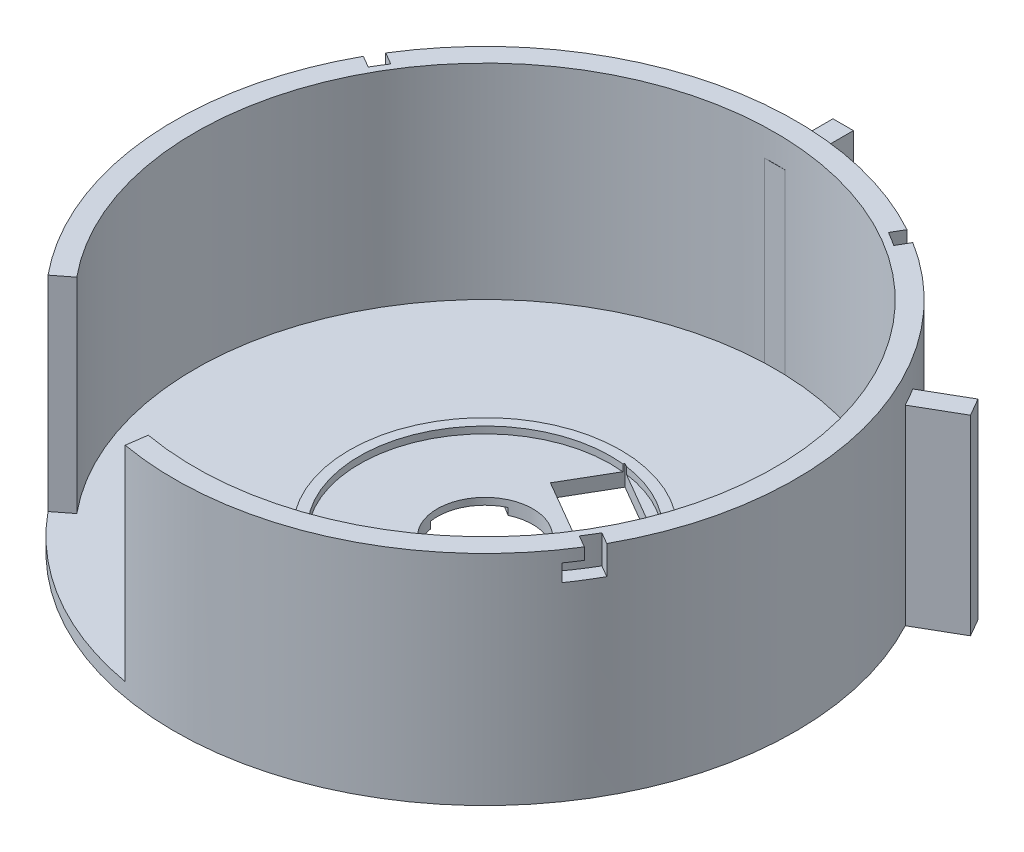
from build123d import *

# Parameters (mm, degrees)
SKETCH1_R                = 45.5
SKETCH1_R_2              = 42.5
BOSS_EXTRUDE1_DEPTH      = 32
SKETCH2_R                = 45.5
BOSS_EXTRUDE2_DEPTH      = 2
SKETCH3_R                = 7
CUT_EXTRUDE1_DEPTH       = 2
BOSS_EXTRUDE4_DEPTH      = 26
BOSS_EXTRUDE4_DEPTH_BACK = 2
SKETCH7_W                = 3
SKETCH7_H                = 10
SKETCH8_R                = 19.890165718
SKETCH8_R_2              = 18.390165718
BOSS_EXTRUDE5_DEPTH      = 1
CUT_EXTRUDE4_DEPTH       = 5.5
CUT_EXTRUDE5_DEPTH       = 58.5
CUT_EXTRUDE6_DEPTH       = 1
SKETCH13_W               = 2.4
SKETCH13_H               = 4.2
CUT_EXTRUDE7_DEPTH       = 2
SKETCH14_W               = 2.232083317
SKETCH14_H               = 2.5
CUT_REVOLVE1_ANGLE       = 6
CUT_REVOLVE2_START       = 30.3
CUT_REVOLVE2_DEPTH       = 1.7
CIRPATTERN1_COUNT        = 4
CUT_REVOLVE3_START       = 30.3
CUT_REVOLVE3_DEPTH       = 1.7
CUT_REVOLVE4_START       = 30.3
CUT_REVOLVE4_DEPTH       = 1.7


# Read off the part's stored shape, not the designer's step: Cut-Revolve2, Cut-Revolve3, Cut-Revolve4
with BuildPart() as part:
    # Sketch1 → Boss-Extrude1 (new body)
    with BuildSketch(Plane(origin=(0, 0, 0), x_dir=(1, 0, 0), z_dir=(0, 1, 0))):
        with Locations(Location((0, 0, 0), (0, 0, 270))):
            Circle(SKETCH1_R)
        with Locations(Location((0, 0, 0), (0, 0, 270))):
            Circle(SKETCH1_R_2, mode=Mode.SUBTRACT)
    extrude(amount=BOSS_EXTRUDE1_DEPTH)

    # Sketch2 → Boss-Extrude2 (add)
    with BuildSketch(Plane.XZ):
        with Locations(Location((0, 0, 0), (0, 0, 90))):
            Circle(SKETCH2_R)
    extrude(amount=-BOSS_EXTRUDE2_DEPTH)

    # Sketch3 → Cut-Extrude1 (cut)
    with BuildSketch(Plane(origin=(0, 2, 0), x_dir=(1, 0, 0), z_dir=(0, 1, 0))):
        with Locations(Location((0, 0, 0), (0, 0, 270))):
            Circle(SKETCH3_R)
    extrude(amount=-CUT_EXTRUDE1_DEPTH, mode=Mode.SUBTRACT)

    # Sketch7 → Boss-Extrude4 (add, two sides: drawn at the far end of the back side and taken through both)
    with BuildSketch(Plane(origin=(0, 2, 0), x_dir=(1, 0, 0), z_dir=(0, 1, 0)).offset(-BOSS_EXTRUDE4_DEPTH_BACK)):
        with Locations((0, 47.473521163)):
            Rectangle(SKETCH7_W, SKETCH7_H)
        Polygon((46.193402353, 24.937722476), (37.533148315, 19.937722476), (36.033148315, 22.535798687), (44.693402353, 27.535798687), align=None)
    extrude(amount=BOSS_EXTRUDE4_DEPTH + BOSS_EXTRUDE4_DEPTH_BACK)

    # Sketch8 → Boss-Extrude5 (add)
    with BuildSketch(Plane(origin=(0, 2, 0), x_dir=(1, 0, 0), z_dir=(0, 1, 0))):
        with Locations(Location((0, 0, 0), (0, 0, 90))):
            Circle(SKETCH8_R)
        with Locations(Location((0, 0, 0), (0, 0, 270))):
            Circle(SKETCH8_R_2, mode=Mode.SUBTRACT)
    extrude(amount=BOSS_EXTRUDE5_DEPTH)

    # Sketch10 → Cut-Extrude4 (cut)
    with BuildSketch(Plane.XZ):
        Polygon((2.016687189, -18.494703278), (14.981867268, -10.951222284), (10.958677405, -4.036459575), (-2.006502675, -11.579940569), align=None)
    extrude(amount=-CUT_EXTRUDE4_DEPTH, mode=Mode.SUBTRACT)

    # Sketch11 → Cut-Extrude5 (cut)
    with BuildSketch(Plane(origin=(0, 2, 0), x_dir=(1, 0, 0), z_dir=(0, 1, 0))):
        Polygon((-32.606600292, -26.874098434), (-35.165226496, -28.87311631), (-33.824988888, -37.754161376), (-11.7382848, -48.772412552), (-7.925983096, -44.804338986), (-7.495155029, -41.738838001), (-9.978475631, -35.419229659), (-25.965270809, -26.874098434), align=None)
    extrude(amount=CUT_EXTRUDE5_DEPTH, mode=Mode.SUBTRACT)

    # Sketch12 → Cut-Extrude6 (cut)
    with BuildSketch(Plane.XZ):
        Polygon((-6.912265346, 1.104802147), (-24.20763883, -9.480307189), (-19.814483018, -16.658435267), (-2.519109534, -6.073325931), align=None)
    extrude(amount=-CUT_EXTRUDE6_DEPTH, mode=Mode.SUBTRACT)

    # Sketch13 → Cut-Extrude7 (cut)
    with BuildSketch(Plane(origin=(22.881892348, 0, -39.327712908), x_dir=(-0.8643453386317811, 0, -0.5028987329328956), z_dir=(0.5028987329328954, 0, -0.864345338631781))):
        with Locations((-0.179431701, 29.9)):
            Rectangle(SKETCH13_W, SKETCH13_H)
    cut_extrude7 = extrude(amount=-CUT_EXTRUDE7_DEPTH, mode=Mode.SUBTRACT)

    # Sketch14 → Cut-Revolve1 (revolve, cut)
    with BuildSketch(Plane(origin=(-0.882123452, 0, -0.513242504), x_dir=(0.5028987329328954, 0, -0.8643453386317812), z_dir=(0.8643453386317812, 0, 0.5028987329328954))):
        with Locations((44.616041659, 29.05)):
            Rectangle(SKETCH14_W, SKETCH14_H)
    cut_revolve1 = revolve(axis=Axis((-0.882123452, 0, -0.513242504), (0, -1, 0)), revolution_arc=CUT_REVOLVE1_ANGLE, mode=Mode.SUBTRACT)

    # Cut-Revolve2 outline → Cut-Revolve2 (cut)
    with BuildSketch(Plane(origin=(0, 0, 0), x_dir=(1, 0, 0), z_dir=(0, 1, 0)).offset(CUT_REVOLVE2_START)):
        with BuildLine():
            ThreePointArc((20.993971431, 38.112264735), (22.023249251, 37.494236289), (23.035079503, 36.848038538))
            Line((23.035079503, 36.848038538), (23.068400244, 36.905307776))
            Line((23.068400244, 36.905307776), (20.993971431, 38.112264735))
        make_face()
    extrude(amount=CUT_REVOLVE2_DEPTH, mode=Mode.SUBTRACT)

    # CirPattern1: Cut-Extrude7, Cut-Revolve1 ×4 about axis
    cirpattern1_axis = Axis((0, 0, 0), (0, 1, 0))
    add([cut_extrude7.rotate(cirpattern1_axis, i * 360 / CIRPATTERN1_COUNT) for i in range(1, CIRPATTERN1_COUNT)], mode=Mode.SUBTRACT)
    add([cut_revolve1.rotate(cirpattern1_axis, i * 360 / CIRPATTERN1_COUNT) for i in range(1, CIRPATTERN1_COUNT)], mode=Mode.SUBTRACT)

    # Cut-Revolve3 outline → Cut-Revolve3 (cut)
    with BuildSketch(Plane(origin=(0, 0, 0), x_dir=(1, 0, 0), z_dir=(0, 1, 0)).offset(CUT_REVOLVE3_START)):
        with BuildLine():
            ThreePointArc((38.112264735, -20.993971431), (37.494236289, -22.023249251), (36.848038538, -23.035079503))
            Line((36.848038538, -23.035079503), (36.905307776, -23.068400244))
            Line((36.905307776, -23.068400244), (38.112264735, -20.993971431))
        make_face()
    extrude(amount=CUT_REVOLVE3_DEPTH, mode=Mode.SUBTRACT)

    # Cut-Revolve4 outline → Cut-Revolve4 (cut)
    with BuildSketch(Plane(origin=(0, 0, 0), x_dir=(1, 0, 0), z_dir=(0, 1, 0)).offset(CUT_REVOLVE4_START)):
        with BuildLine():
            ThreePointArc((-38.112264735, 20.993971431), (-37.494236289, 22.023249251), (-36.848038538, 23.035079503))
            Line((-36.848038538, 23.035079503), (-36.905307776, 23.068400244))
            Line((-36.905307776, 23.068400244), (-38.112264735, 20.993971431))
        make_face()
    extrude(amount=CUT_REVOLVE4_DEPTH, mode=Mode.SUBTRACT)


solid = part.part
